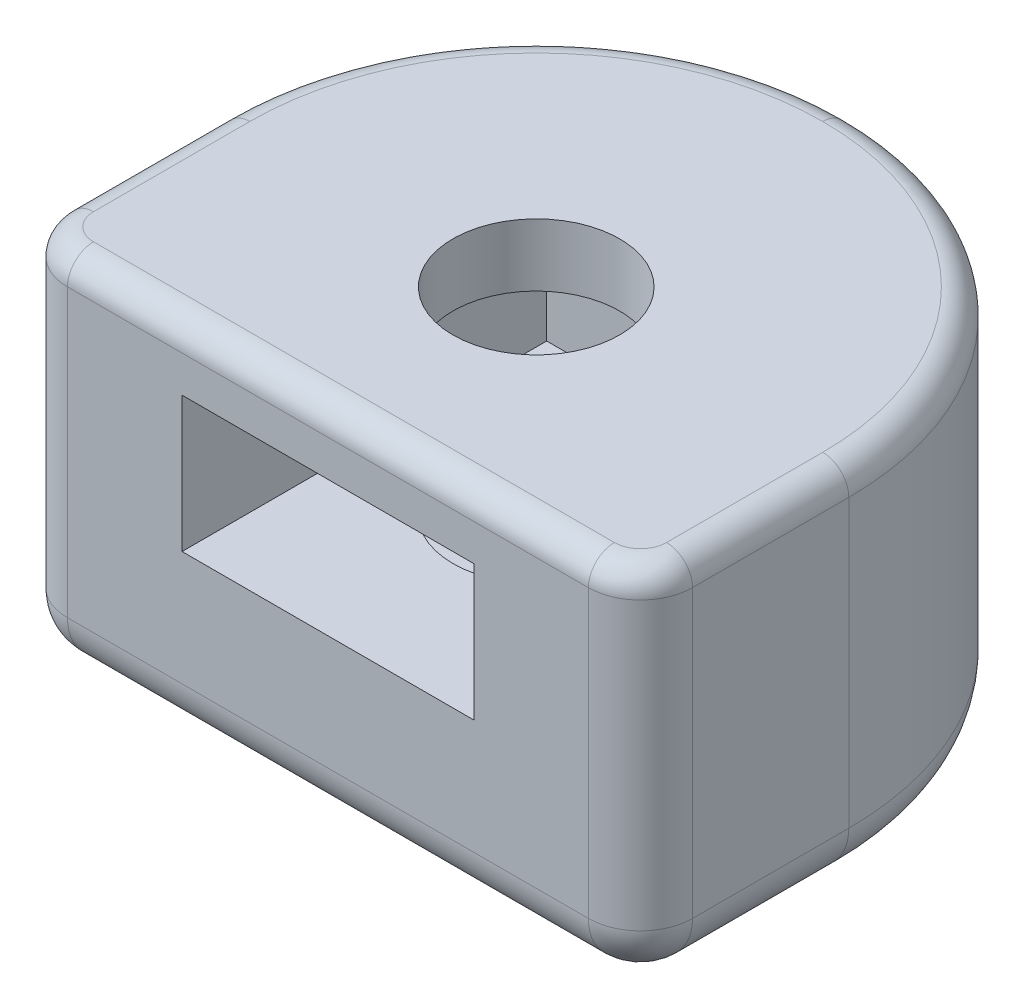
from build123d import *

# Parameters (mm, degrees)
SKETCH1_W           = 12
SKETCH1_H           = 10
BOSS_EXTRUDE1_DEPTH = 7
SKETCH2_R           = 1.6
CUT_EXTRUDE1_DEPTH  = 4
SKETCH3_W           = 5.6
SKETCH3_H           = 2.6
CUT_EXTRUDE2_DEPTH  = 7
FILLET1_R           = 6
FILLET2_R           = 1
FILLET3_R           = 1
FILLET4_R           = 0.5


with BuildPart() as part:
    # Sketch1 → Boss-Extrude1 (new body)
    with BuildSketch(Plane(origin=(0, 0, 0), x_dir=(1, 0, 0), z_dir=(0, 1, 0))):
        with Locations((6, 5)):
            Rectangle(SKETCH1_W, SKETCH1_H)
    extrude(amount=BOSS_EXTRUDE1_DEPTH)

    # Sketch2 → Cut-Extrude1 (cut)
    with BuildSketch(Plane(origin=(0, 7, 0), x_dir=(1, 0, 0), z_dir=(0, 1, 0))):
        with Locations(Location((6, 4, 0), (0, 0, 270))):
            Circle(SKETCH2_R)
    extrude(amount=-CUT_EXTRUDE1_DEPTH, mode=Mode.SUBTRACT)

    # Sketch3 → Cut-Extrude2 (cut)
    with BuildSketch(Plane.XY):
        with Locations((6, 4.5)):
            Rectangle(SKETCH3_W, SKETCH3_H)
    extrude(amount=-CUT_EXTRUDE2_DEPTH, mode=Mode.SUBTRACT)

    # Fillet1
    fillet1_edges = [part.edges().sort_by_distance(p)[0] for p in [
        (0, 3.5, -10),
        (12, 3.5, -10),
    ]]
    fillet(fillet1_edges, radius=FILLET1_R - 0.0001)  # a hair under: the kernel refuses the full size

    # Fillet2
    fillet2_edges = [part.edges().sort_by_distance(p)[0] for p in [
        (0, 0, -2.00005),
        (10.242669976, 0, -8.242669976),
        (1.757330024, 0, -8.242669976),
        (12, 0, -2.00005),
    ]]
    fillet(fillet2_edges, radius=FILLET2_R)

    # Fillet3
    fillet3_edges = [part.edges().sort_by_distance(p)[0] for p in [
        (6, 0, 0),
        (11.707106781, 0.292893219, 0),
        (0.292893219, 0.292893219, 0),
        (12, 4, 0),
        (0, 4, 0),
    ]]
    fillet(fillet3_edges, radius=FILLET3_R)

    # Fillet4
    fillet4_edges = [part.edges().sort_by_distance(p)[0] for p in [
        (0, 7, -2.50005),
        (10.242669976, 7, -8.242669976),
        (1.757330024, 7, -8.242669976),
        (6, 7, 0),
        (12, 7, -2.50005),
        (11.707106781, 7, -0.292893219),
        (0.292893219, 7, -0.292893219),
    ]]
    fillet(fillet4_edges, radius=FILLET4_R)


solid = part.part
